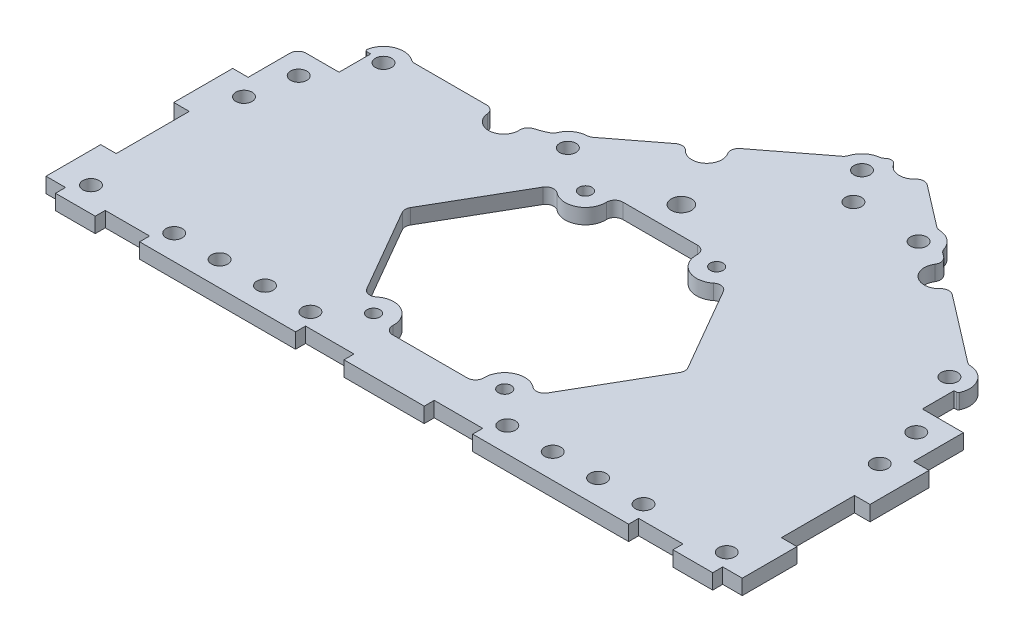
from build123d import *

# Parameters (mm, degrees)
SKETCH44_R              = 2.5527
TOP_PLATE_EXTRUDE_DEPTH = 4.7625
SKETCH82_R              = 4.7625
CUT_EXTRUDE38_DEPTH     = 4.7625
SKETCH72_W              = 4.7498
SKETCH72_H              = 17.4625
SKETCH72_W_2            = 49.2125
SKETCH72_H_2            = 3.0226
SKETCH72_H_3            = 18.806813894
SKETCH72_W_3            = 12.7
SKETCH72_H_4            = 9.525
BOSS_EXTRUDE27_DEPTH    = 4.7625
SKETCH86_R              = 6.35
SKETCH86_R_2            = 2.5527
BOSS_EXTRUDE31_DEPTH    = 4.7625
SKETCH111_W             = 17.7673
SKETCH111_H             = 9.9695
CUT_EXTRUDE57_DEPTH     = 191.299871995
SKETCH92_W              = 4.859785226
SKETCH92_H              = 15.6845
SKETCH92_W_2            = 4.8768
SKETCH92_H_2            = 22.987
SKETCH92_W_3            = 6.1468
SKETCH92_H_3            = 3.1496
SKETCH92_W_4            = 13.95095
SKETCH92_W_5            = 15.24635
CUT_EXTRUDE44_DEPTH     = 191.299871995
SKETCH95_R              = 2.0193
CUT_EXTRUDE47_DEPTH     = 25.4
SKETCH99_R              = 3.175
CUT_EXTRUDE50_DEPTH     = 191.299871995
FILLET5_R               = 2.54
FILLET6_R               = 2.54
FILLET7_R               = 2.54
FILLET8_R               = 1.905
FILLET42_R              = 0.635


with BuildPart() as part:
    # Sketch44 → Top Plate Extrude----------- (new body)
    with BuildSketch(Plane(origin=(0, 25.4, 0), x_dir=(1, 0, 0), z_dir=(0, 1, 0))):
        with BuildLine():
            Line((-104.775, -68.124686106), (-104.775, -152.527))
            Line((-104.775, -152.527), (104.775, -152.527))
            Line((104.775, -152.527), (104.775, -68.124686106))
            Line((104.775, -68.124686106), (92.075, -68.124686106))
            Line((92.075, -68.124686106), (92.075, -62.647632589))
            Line((92.075, -62.647632589), (21.81178084, -8.732768266))
            ThreePointArc((21.81178084, -8.732768266), (18.724426226, -14.191930366), (14.302849775, -18.63983673))
            Line((14.302849775, -18.63983673), (-38.049902469, -58.811516421))
            ThreePointArc((-38.049902469, -58.811516421), (-44.800532006, -62.419803084), (-52.352752243, -63.666679691))
            Line((-52.352752243, -63.666679691), (-92.075, -63.666679691))
            Line((-92.075, -63.666679691), (-92.075, -68.124686106))
            Line((-92.075, -68.124686106), (-104.775, -68.124686106))
        make_face()
        with Locations(Location((-73.83145, -147.7645, 0), (0, 0, 90))):
            Circle(SKETCH44_R, mode=Mode.SUBTRACT)
        with Locations(Location((-59.54395, -147.7645, 0), (0, 0, 90))):
            Circle(SKETCH44_R, mode=Mode.SUBTRACT)
        with Locations(Location((-45.25645, -147.7645, 0), (0, 0, 90))):
            Circle(SKETCH44_R, mode=Mode.SUBTRACT)
        with Locations(Location((-30.96895, -147.7645, 0), (0, 0, 90))):
            Circle(SKETCH44_R, mode=Mode.SUBTRACT)
        with Locations(Location((-100.0125, -99.6315, 0), (0, 0, 90))):
            Circle(SKETCH44_R, mode=Mode.SUBTRACT)
        with Locations(Location((-100.0125, -147.7645, 0), (0, 0, 90))):
            Circle(SKETCH44_R, mode=Mode.SUBTRACT)
        with Locations(Location((100.0125, -147.7645, 0), (0, 0, 90))):
            Circle(SKETCH44_R, mode=Mode.SUBTRACT)
        with Locations(Location((100.0125, -99.6315, 0), (0, 0, 90))):
            Circle(SKETCH44_R, mode=Mode.SUBTRACT)
        with Locations(Location((30.96895, -147.7645, 0), (0, 0, 90))):
            Circle(SKETCH44_R, mode=Mode.SUBTRACT)
        with Locations(Location((45.25645, -147.7645, 0), (0, 0, 90))):
            Circle(SKETCH44_R, mode=Mode.SUBTRACT)
        with Locations(Location((59.54395, -147.7645, 0), (0, 0, 90))):
            Circle(SKETCH44_R, mode=Mode.SUBTRACT)
        with Locations(Location((73.83145, -147.7645, 0), (0, 0, 90))):
            Circle(SKETCH44_R, mode=Mode.SUBTRACT)
        with Locations(Location((-87.3125, -68.429179691, 0), (0, 0, 90))):
            Circle(SKETCH44_R, mode=Mode.SUBTRACT)
        with Locations(Location((-35.150676163, -62.589861704, 0), (0, 0, 90))):
            Circle(SKETCH44_R, mode=Mode.SUBTRACT)
        with Locations(Location((17.20207608, -22.418182013, 0), (0, 0, 90))):
            Circle(SKETCH44_R, mode=Mode.SUBTRACT)
        with Locations(Location((45.531325629, -32.936414996, 0), (0, 0, 90))):
            Circle(SKETCH44_R, mode=Mode.SUBTRACT)
        with Locations(Location((87.3125, -64.996237681, 0), (0, 0, 90))):
            Circle(SKETCH44_R, mode=Mode.SUBTRACT)
        with Locations(Location((-97.155, -85.269686106, 0), (0, 0, 90))):
            Circle(SKETCH44_R, mode=Mode.SUBTRACT)
        with Locations(Location((24.512056641, -32.4155623, 0), (0, 0, 90))):
            Circle(SKETCH44_R, mode=Mode.SUBTRACT)
        with Locations(Location((97.155, -85.269686106, 0), (0, 0, 90))):
            Circle(SKETCH44_R, mode=Mode.SUBTRACT)
    extrude(amount=TOP_PLATE_EXTRUDE_DEPTH)

    # Sketch82 → Cut-Extrude38 (cut)
    with BuildSketch(Plane(origin=(0, 30.1625, 0), x_dir=(1, 0, 0), z_dir=(0, 1, 0))):
        with Locations((-52.352752243, -65.571679691)):
            Circle(SKETCH82_R)
        with Locations((-12.44667807, -41.56667131)):
            Circle(SKETCH82_R)
        with Locations((58.296246284, -39.129483192)):
            Circle(SKETCH82_R)
        with BuildLine():
            Line((21.464274093, -9.555101394), (21.81178084, -8.732768266))
            Line((21.81178084, -8.732768266), (22.214272521, -9.041610995))
            ThreePointArc((22.214272521, -9.041610995), (27.20799018, -17.139845005), (21.464274093, -9.555101394))
        make_face()
    extrude(amount=-CUT_EXTRUDE38_DEPTH, mode=Mode.SUBTRACT)

    # Sketch72 → Boss-Extrude27 (add, through all)
    with BuildSketch(Plane(origin=(0, 25.4, 0), x_dir=(1, 0, 0), z_dir=(0, 1, 0))):
        with Locations((-107.1499, -143.79575)):
            Rectangle(SKETCH72_W, SKETCH72_H)
        with Locations((-52.4002, -154.0383)):
            Rectangle(SKETCH72_W_2, SKETCH72_H_2)
        with Locations((-107.1499, -102.928093053)):
            Rectangle(SKETCH72_W, SKETCH72_H_3)
        with Locations((-6.35, -154.0383)):
            Rectangle(SKETCH72_W_3, SKETCH72_H_2)
        with Locations((-107.1499, -72.887186106)):
            Rectangle(SKETCH72_W, SKETCH72_H_4)
        with Locations((-97.155, -154.0383)):
            Rectangle(SKETCH72_W_3, SKETCH72_H_2)
    boss_extrude27 = extrude(amount=BOSS_EXTRUDE27_DEPTH)

    # Mirror22: Boss-Extrude27 across plane
    add(boss_extrude27.mirror(Plane(origin=(0, 0, 0), x_dir=(0, 0, 1), z_dir=(1, 0, 0))))

    # Sketch86 → Boss-Extrude31 (add, through all)
    # profile 1 of 5: a face of its own
    with BuildSketch(Plane(origin=(0, 30.1625, 0), x_dir=(1, 0, 0), z_dir=(0, 1, 0))):
        with Locations((87.3125, -64.996237681)):
            Circle(SKETCH86_R)
        with Locations(Location((87.3125, -64.996237681, 0), (0, 0, 90))):
            Circle(SKETCH86_R_2, mode=Mode.SUBTRACT)
    # profile 2 of 5: a face of its own
    with BuildSketch(Plane(origin=(0, 30.1625, 0), x_dir=(1, 0, 0), z_dir=(0, 1, 0))):
        with Locations((17.20207608, -22.418182013)):
            Circle(SKETCH86_R)
        with Locations(Location((17.20207608, -22.418182013, 0), (0, 0, 90))):
            Circle(SKETCH86_R_2, mode=Mode.SUBTRACT)
    # profile 3 of 5: a face of its own
    with BuildSketch(Plane(origin=(0, 30.1625, 0), x_dir=(1, 0, 0), z_dir=(0, 1, 0))):
        with Locations((45.531325629, -32.936414996)):
            Circle(SKETCH86_R)
        with Locations(Location((45.531325629, -32.936414996, 0), (0, 0, 90))):
            Circle(SKETCH86_R_2, mode=Mode.SUBTRACT)
    # profile 4 of 5: a face of its own
    with BuildSketch(Plane(origin=(0, 30.1625, 0), x_dir=(1, 0, 0), z_dir=(0, 1, 0))):
        with Locations((-35.150676163, -62.589861704)):
            Circle(SKETCH86_R)
        with Locations(Location((-35.150676163, -62.589861704, 0), (0, 0, 90))):
            Circle(SKETCH86_R_2, mode=Mode.SUBTRACT)
    # profile 5 of 5: a face of its own
    with BuildSketch(Plane(origin=(0, 30.1625, 0), x_dir=(1, 0, 0), z_dir=(0, 1, 0))):
        with Locations((-87.3125, -68.429179691)):
            Circle(SKETCH86_R)
        with Locations(Location((-87.3125, -68.429179691, 0), (0, 0, 90))):
            Circle(SKETCH86_R_2, mode=Mode.SUBTRACT)
    extrude(amount=-BOSS_EXTRUDE31_DEPTH)

    # Sketch111 → Cut-Extrude57 (cut, through all)
    with BuildSketch(Plane(origin=(0, 30.1625, 0), x_dir=(1, 0, 0), z_dir=(0, 1, 0))):
        with Locations((-100.64115, -72.982436106)):
            Rectangle(SKETCH111_W, SKETCH111_H)
        with Locations((100.64115, -72.982436106)):
            Rectangle(SKETCH111_W, SKETCH111_H)
    extrude(amount=-CUT_EXTRUDE57_DEPTH, mode=Mode.SUBTRACT)

    # Sketch92 → Cut-Extrude44 (cut, through all)
    with BuildSketch(Plane(origin=(0, 30.1625, 0), x_dir=(1, 0, 0), z_dir=(0, 1, 0))):
        with Locations((-107.094907387, -85.809436106)):
            Rectangle(SKETCH92_W, SKETCH92_H)
        with Locations((-107.0864, -123.698)):
            Rectangle(SKETCH92_W_2, SKETCH92_H_2)
        with Locations((-106.4514, -153.9748)):
            Rectangle(SKETCH92_W_3, SKETCH92_H_3)
        with Locations((-83.905725, -153.9748)):
            Rectangle(SKETCH92_W_4, SKETCH92_H_3)
        with Locations((-20.246975, -153.9748)):
            Rectangle(SKETCH92_W_5, SKETCH92_H_3)
    cut_extrude44 = extrude(amount=-CUT_EXTRUDE44_DEPTH, mode=Mode.SUBTRACT)

    # Mirror26: Cut-Extrude44 across plane
    add(cut_extrude44.mirror(Plane(origin=(0, 0, 0), x_dir=(0, 0, 1), z_dir=(1, 0, 0))), mode=Mode.SUBTRACT)

    # Sketch95 → Cut-Extrude47 (cut)
    with BuildSketch(Plane(origin=(0, 30.1625, 0), x_dir=(1, 0, 0), z_dir=(0, 1, 0))):
        with BuildLine():
            Line((-14.966768676, -141.097), (14.966768676, -141.097))
            ThreePointArc((14.966768676, -141.097), (18.013644543, -132.45695017), (26.522246674, -135.853654954))
            Line((26.522246674, -135.853654954), (44.392192993, -104.902))
            Line((44.392192993, -104.902), (26.522246674, -73.950345046))
            ThreePointArc((26.522246674, -73.950345046), (18.013644543, -77.34704983), (14.966768676, -68.707))
            Line((14.966768676, -68.707), (-14.966768676, -68.707))
            ThreePointArc((-14.966768676, -68.707), (-18.013644543, -77.34704983), (-26.522246674, -73.950345046))
            Line((-26.522246674, -73.950345046), (-44.392192993, -104.902))
            Line((-44.392192993, -104.902), (-26.522246674, -135.853654954))
            ThreePointArc((-26.522246674, -135.853654954), (-18.013644543, -132.45695017), (-14.966768676, -141.097))
        make_face()
        with Locations(Location((-20.6375, -71.5645, 0), (0, 0, 270))):
            Circle(SKETCH95_R)
        with Locations(Location((20.6375, -71.5645, 0), (0, 0, 270))):
            Circle(SKETCH95_R)
        with Locations(Location((20.6375, -138.2395, 0), (0, 0, 270))):
            Circle(SKETCH95_R)
        with Locations(Location((-20.6375, -138.2395, 0), (0, 0, 270))):
            Circle(SKETCH95_R)
    extrude(amount=-CUT_EXTRUDE47_DEPTH, mode=Mode.SUBTRACT)

    # Sketch99 → Cut-Extrude50 (cut, through all)
    with BuildSketch(Plane(origin=(0, 30.1625, 0), x_dir=(1, 0, 0), z_dir=(0, 1, 0))):
        with Locations(Location((-1.83388, -60.19546, 0), (0, 0, 270))):
            Circle(SKETCH99_R)
    extrude(amount=-CUT_EXTRUDE50_DEPTH, mode=Mode.SUBTRACT)

    # Fillet5
    fillet5_edges = [part.edges().sort_by_distance(p)[0] for p in [
        (26.522246674, 27.78125, 135.853654954),
        (14.966768676, 27.78125, 141.097),
        (-14.966768676, 27.78125, 141.097),
        (-26.522246674, 27.78125, 135.853654954),
        (-44.392192993, 27.78125, 104.902),
        (-26.522246674, 27.78125, 73.950345046),
        (-14.966768676, 27.78125, 68.707),
        (14.966768676, 27.78125, 68.707),
        (26.522246674, 27.78125, 73.950345046),
        (44.392192993, 27.78125, 104.902),
    ]]
    fillet(fillet5_edges, radius=FILLET5_R)

    # Fillet6
    # the kernel refuses this fillet: 2.54 mm, written as the material it takes off along each edge
    with BuildSketch(Plane(origin=(-92.075, 23.994075516, 63.666679691), x_dir=(1, 0, 0), z_dir=(0, 1, 0))) as fillet6_piece_1:
        with BuildLine():
            CenterArc((2.055088799, -2.055088799), FILLET6_R, 125.992875358, 18.014249284)
            Line((0, -0.562369794), (0, 0))
            Line((0, 0), (0.562369794, 0))
        make_face()
    extrude(amount=7.574348968, mode=Mode.SUBTRACT)

    # Fillet7
    fillet7_edges = [part.edges().sort_by_distance(p)[0] for p in [
        (-56.717655593, 27.78125, 63.666679691),
        (-17.069279245, 27.78125, 42.712517997),
        (-10.14345794, 27.78125, 37.398148396),
        (55.993026154, 27.78125, 34.960960278),
        (62.918847459, 27.78125, 40.275329879),
        (-48.171509306, 27.78125, 63.291632816),
        (29.140093826, 27.78125, 14.355980596),
        (86.879538977, 27.78125, 58.661015131),
        (17.141153982, 27.78125, 16.068474264),
        (10.970662446, 27.78125, 21.196713997),
        (51.762739264, 27.78125, 31.71494698),
        (45.098364606, 27.78125, 26.601192447),
        (-41.268255068, 27.78125, 60.88759018),
        (-34.71771514, 27.78125, 56.254639155),
        (-83.112369794, 27.78125, 63.666679691),
        (-104.665014774, 27.78125, 77.967186106),
    ]]
    fillet(fillet7_edges, radius=FILLET7_R)

    # Fillet8
    fillet8_edges = [part.edges().sort_by_distance(p)[0] for p in [
        (19.785658887, 27.78125, 12.670545663),
    ]]
    fillet(fillet8_edges, radius=FILLET8_R)

    # Fillet42
    fillet42_edges = [part.edges().sort_by_distance(p)[0] for p in [
        (-93.647822666, 27.78125, 67.997686106),
        (92.908374136, 27.78125, 67.997686106),
    ]]
    fillet(fillet42_edges, radius=FILLET42_R)


solid = part.part
